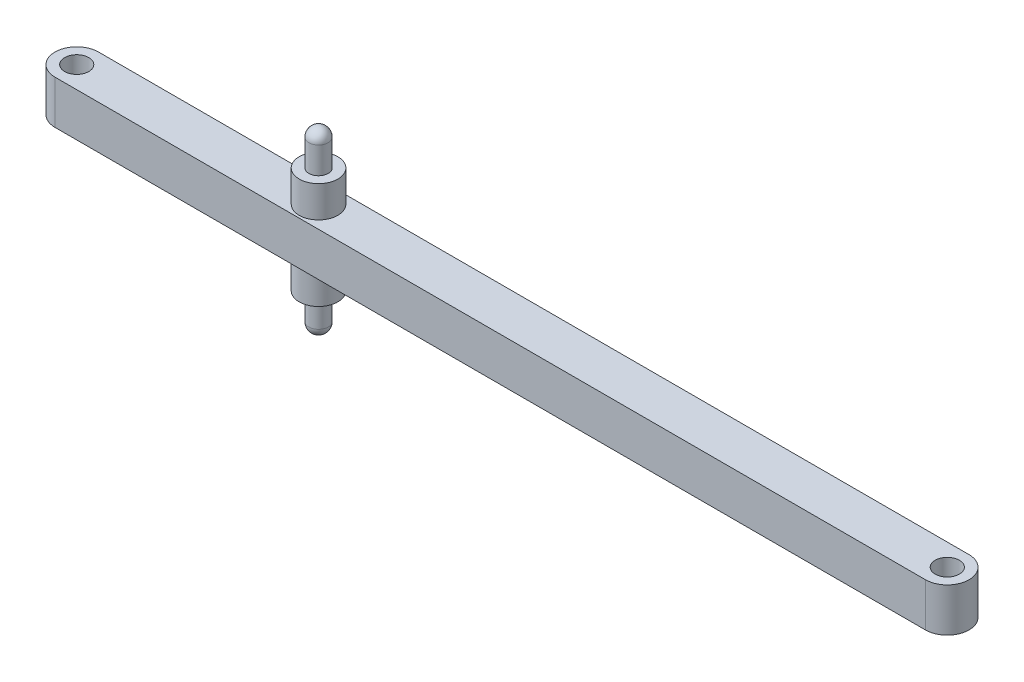
from build123d import *

# Parameters (mm, degrees)
BOSS_EXTRUDE1_DEPTH          = 9
SKETCH2_R                    = 4
BOSS_EXTRUDE2_DEPTH          = 6.5
BOSS_EXTRUDE4_START          = 6.5
SKETCH4_R                    = 4
BOSS_EXTRUDE4_DEPTH          = 6.5
F_5_0_5_DIAMETER_HOLE1_D     = 5
F_5_0_5_DIAMETER_HOLE1_DEPTH = 23


# Read off the part's stored shape, not the designer's step: Boss-Extrude3, Boss-Extrude5
with BuildPart() as part:
    # Sketch1 → Boss-Extrude1 (new body)
    with BuildSketch(Plane(origin=(0, 4.5, 0), x_dir=(1, 0, 0), z_dir=(0, 1, 0))):
        with BuildLine():
            Line((-60, -43.5), (120, -43.5))
            ThreePointArc((120, -43.5), (124.5, -39), (120, -34.5))
            Line((120, -34.5), (-60, -34.5))
            ThreePointArc((-60, -34.5), (-64.5, -39), (-60, -43.5))
        make_face()
    extrude(amount=-BOSS_EXTRUDE1_DEPTH)

    # Sketch2 → Boss-Extrude2 (add)
    with BuildSketch(Plane.XZ.offset(4.5)):
        with Locations(Location((-10, 39, 0), (0, 0, 90))):
            Circle(SKETCH2_R)
    extrude(amount=BOSS_EXTRUDE2_DEPTH)

    # Boss-Extrude3 outline → Boss-Extrude3 (revolve)
    with BuildSketch(Plane(origin=(-10, 0, 39), x_dir=(1, 0, 0), z_dir=(0, 0, 1))):
        with BuildLine():
            ThreePointArc((0, -18.5), (1.414213563, -17.914213562), (2, -16.499999998))
            Line((2, -16.499999998), (2, -11))
            Line((2, -11), (0, -11))
            Line((0, -11), (0, -18.5))
        make_face()
    revolve(axis=Axis((-10, 0, 39), (0, 1, 0)))

    # Sketch4 → Boss-Extrude4 (add)
    with BuildSketch(Plane(origin=(0, 4.5, 0), x_dir=(-1, 0, 0), z_dir=(0, 1, 0)).offset(BOSS_EXTRUDE4_START)):
        with Locations(Location((10, 39, 0), (0, 0, 90))):
            Circle(SKETCH4_R)
    extrude(amount=-BOSS_EXTRUDE4_DEPTH)

    # Boss-Extrude5 outline → Boss-Extrude5 (revolve)
    with BuildSketch(Plane(origin=(-10, 0, 39), x_dir=(1, 0, 0), z_dir=(0, 0, 1))):
        with BuildLine():
            Line((2, 11), (2, 16.499999998))
            ThreePointArc((2, 16.499999998), (1.414213563, 17.914213562), (0, 18.5))
            Line((0, 18.5), (0, 11))
            Line((0, 11), (2, 11))
        make_face()
    revolve(axis=Axis((-10, 0, 39), (0, 1, 0)))

    # Ø5.0 (5) Diameter Hole1
    with Locations(Plane(origin=(0, 4.5, 0), x_dir=(1, 0, 0), z_dir=(0, 1, 0))):
        with Locations((-60, -39), (120, -39)):
            Hole(F_5_0_5_DIAMETER_HOLE1_D / 2, depth=F_5_0_5_DIAMETER_HOLE1_DEPTH)


solid = part.part
